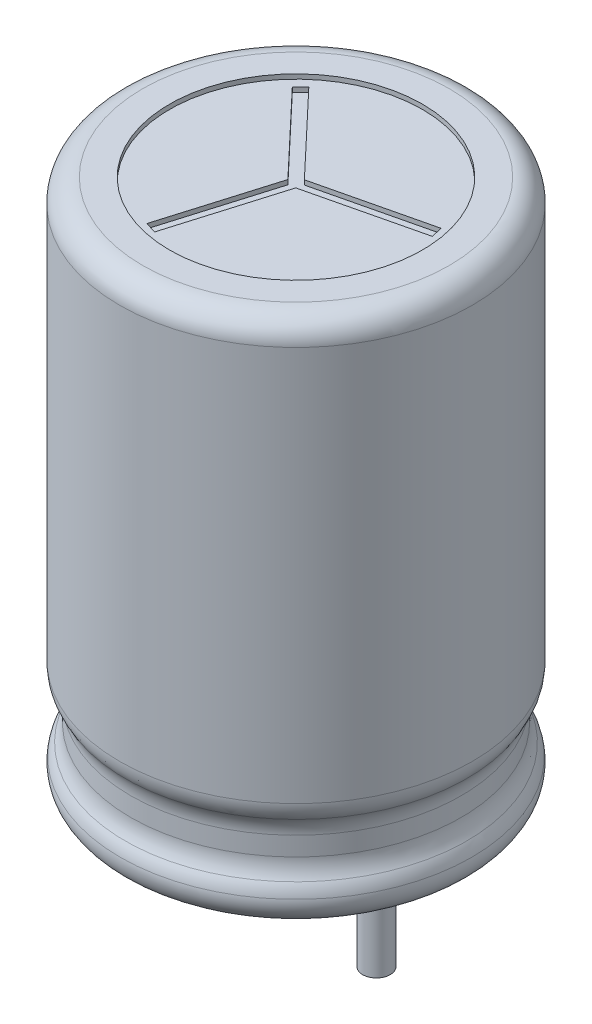
from build123d import *

# Parameters (mm, degrees)
SKETCH2_R          = 2.75
CUT_EXTRUDE1_DEPTH = 0.1
CUT_EXTRUDE2_DEPTH = 0.1
SKETCH4_W          = 0.3
SKETCH4_H          = 2.5
SKETCH5_W          = 0.3
SKETCH5_H          = 2.5
FILLET1_R          = 0.5


with BuildPart() as part:
    # Sketch1 → Revolve1 (revolve)
    with BuildSketch(Plane.XY):
        with BuildLine():
            Line((3.833333333, 11.5), (0, 11.5))
            Line((0, 11.5), (0, 0))
            Line((0, 0), (3.643923536, 0))
            ThreePointArc((3.643923536, 0), (3.831196182, 0.41247412), (3.713594331, 0.849939259))
            ThreePointArc((3.713594331, 0.849939259), (3.624411813, 1.032105149), (3.59375, 1.232599004))
            Line((3.59375, 1.232599004), (3.59375, 1.642400996))
            ThreePointArc((3.59375, 1.642400996), (3.624398017, 1.842850794), (3.713541667, 2.024984899))
            ThreePointArc((3.713541667, 2.024984899), (3.802685317, 2.207119004), (3.833333333, 2.407568802))
            Line((3.833333333, 2.407568802), (3.833333333, 11.5))
        make_face()
    revolve(axis=Axis((0, 11.5, 0), (0, -1, 0)))

    # Sketch2 → Cut-Extrude1 (cut)
    with BuildSketch(Plane(origin=(0, 11.5, 0), x_dir=(-1, 0, 0), z_dir=(0, 1, 0))):
        Circle(SKETCH2_R)
    extrude(amount=-CUT_EXTRUDE1_DEPTH, mode=Mode.SUBTRACT)

    # Sketch3 → Cut-Extrude2 (cut)
    with BuildSketch(Plane(origin=(0, 11.4, 0), x_dir=(-1, 0, 0), z_dir=(0, 1, 0))):
        Polygon((1.653472744, -1.932293167), (1.837973446, -1.757720858), (0.142645036, 0.03402539), (0.846678598, 2.398095985), (0.603244193, 2.470592124), (-0.10078937, 0.10652153), (-2.500151342, -0.465802817), (-2.441217638, -0.712871266), (-0.041855666, -0.14054692), align=None)
    extrude(amount=-CUT_EXTRUDE2_DEPTH, mode=Mode.SUBTRACT)

    # Sketch4 → Revolve2 (revolve)
    with BuildSketch(Plane(origin=(0, 0, 0), x_dir=(-1, 0, 0), z_dir=(0, 0, -1))):
        with Locations((-1.9, -1.25)):
            Rectangle(SKETCH4_W, SKETCH4_H)
    revolve(axis=Axis((1.75, -2.5, 0), (0, 1, 0)))

    # Sketch5 → Revolve3 (revolve)
    with BuildSketch(Plane(origin=(0, 0, 0), x_dir=(-1, 0, 0), z_dir=(0, 0, -1))):
        with Locations((1.6, -1.25)):
            Rectangle(SKETCH5_W, SKETCH5_H)
    revolve(axis=Axis((-1.75, -2.5, 0), (0, 1, 0)))

    # Fillet1
    fillet1_edges = [part.edges().sort_by_distance(p)[0] for p in [
        (-3.833333333, 11.5, 0),
        (-3.643923536, 0, 0),
    ]]
    fillet(fillet1_edges, radius=FILLET1_R)


solid = part.part
